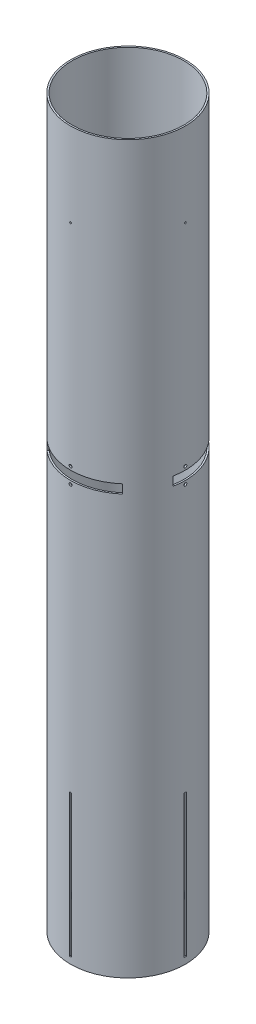
from build123d import *

# Parameters (mm, degrees)
SKETCH1_R                 = 78.359
SKETCH1_R_2               = 76.2
BOSS_EXTRUDE1_DEPTH       = 990.6
FIN_SLOTS_DEPTH           = 997.779125866
CIRPATTERN1_COUNT         = 4
CUT_EXTRUDE2_DEPTH        = 997.779125866
CIRPATTERN2_COUNT         = 4
SKETCH3_R                 = 3.175
CUT_EXTRUDE3_DEPTH        = 997.779125982
CUT_EXTRUDE4_START        = -12.065
CUT_EXTRUDE4_DEPTH        = 12.065
CIRPATTERN3_COUNT         = 3
SKETCH2_4_R               = 1.0922
SHEAR_SCREW_HOLES_DEPTH   = 997.779125982
SHEAR_SCREW_PATTERN_COUNT = 4
LPATTERN1_COUNT           = 2
LPATTERN1_PITCH           = 21.52396
LPATTERN1_COPY_1_DEPTH    = 997.779125866
LPATTERN1_COPY_2_DEPTH    = 997.779125866
LPATTERN1_COPY_3_DEPTH    = 997.779125866


with BuildPart() as part:
    # Sketch1 → Boss-Extrude1 (new body)
    with BuildSketch(Plane(origin=(0, 0, 0), x_dir=(1, 0, 0), z_dir=(0, 1, 0))):
        Circle(SKETCH1_R)
        Circle(SKETCH1_R_2, mode=Mode.SUBTRACT)
    extrude(amount=BOSS_EXTRUDE1_DEPTH)

    # Sketch2 → Fin Slots (cut, through all)
    with BuildSketch(Plane(origin=(0, 0, 0), x_dir=(0, 0, -1), z_dir=(1, 0, 0))):
        Polygon((0, 8.89), (1.5875, 8.89), (1.5875, 203.2), (-1.5875, 203.2), (-1.5875, 8.89), align=None)
    fin_slots = extrude(amount=-FIN_SLOTS_DEPTH, mode=Mode.SUBTRACT)

    # CirPattern1: Fin Slots ×4 about axis
    cirpattern1_axis = Axis((0, 0, 0), (0, 1, 0))
    for i in range(1, CIRPATTERN1_COUNT):
        add(fin_slots.rotate(cirpattern1_axis, i * 360 / CIRPATTERN1_COUNT), mode=Mode.SUBTRACT)

    # Sketch2<3> → Cut-Extrude2 (cut, through all)
    with BuildSketch(Plane(origin=(0, 0, 0), x_dir=(0, 0, -1), z_dir=(1, 0, 0))):
        with BuildLine():
            ThreePointArc((1.999996, 588.645), (1.414210734, 590.059210734), (0, 590.644996))
            ThreePointArc((0, 590.644996), (-1.414210734, 587.230789266), (1.999996, 588.645))
        make_face()
    cut_extrude2 = extrude(amount=-CUT_EXTRUDE2_DEPTH, mode=Mode.SUBTRACT)

    # CirPattern2: Cut-Extrude2 ×4 about axis
    cirpattern2_axis = Axis((0, 990.6, 0), (0, -1, 0))
    for i in range(1, CIRPATTERN2_COUNT):
        add(cut_extrude2.rotate(cirpattern2_axis, i * 360 / CIRPATTERN2_COUNT), mode=Mode.SUBTRACT)

    # Sketch3 → Cut-Extrude3 (cut, through all)
    with BuildSketch(Plane(origin=(0, 0, 0), x_dir=(0.7071067811865477, 0, -0.7071067811865475), z_dir=(0.7071067811865475, 0, 0.7071067811865477))):
        with Locations((0, 127)):
            Circle(SKETCH3_R)
    extrude(amount=-CUT_EXTRUDE3_DEPTH, mode=Mode.SUBTRACT)

    # Sketch7 → Cut-Extrude4 (cut)
    with BuildSketch(Plane(origin=(0, 583.8825, 0), x_dir=(1, 0, 0), z_dir=(0, 1, 0)).offset(CUT_EXTRUDE4_START)):
        with BuildLine():
            Line((-76.853353787, -15.287082543), (-74.735838367, -14.865882538))
            ThreePointArc((-74.735838367, -14.865882538), (-65.991135768, 38.1), (-24.493687256, 72.156075868))
            Line((-24.493687256, 72.156075868), (-25.187675062, 74.200498017))
            ThreePointArc((-25.187675062, 74.200498017), (-63.106141662, 46.451563651), (-78.333472392, 1.999996))
            ThreePointArc((-78.333472392, 1.999996), (-78.359, 0), (-78.333472392, -1.999996))
            ThreePointArc((-78.333472392, -1.999996), (-77.877303639, -8.675163336), (-76.853353787, -15.287082543))
        make_face()
    cut_extrude4 = extrude(amount=CUT_EXTRUDE4_DEPTH, mode=Mode.SUBTRACT)

    # CirPattern3: Cut-Extrude4 ×3 about axis
    cirpattern3_axis = Axis((0, 990.6, 0), (0, -1, 0))
    for i in range(1, CIRPATTERN3_COUNT):
        add(cut_extrude4.rotate(cirpattern3_axis, i * 360 / CIRPATTERN3_COUNT), mode=Mode.SUBTRACT)

    # Sketch2<4> → Shear Screw Holes (cut, through all)
    with BuildSketch(Plane(origin=(0, 0, 0), x_dir=(0, 0, -1), z_dir=(1, 0, 0))):
        with Locations((0, 876.3)):
            Circle(SKETCH2_4_R)
    shear_screw_holes = extrude(amount=-SHEAR_SCREW_HOLES_DEPTH, mode=Mode.SUBTRACT)

    # Shear Screw Pattern: Shear Screw Holes ×4 about axis
    shear_screw_pattern_axis = Axis((0, 990.6, 0), (0, -1, 0))
    for i in range(1, SHEAR_SCREW_PATTERN_COUNT):
        add(shear_screw_holes.rotate(shear_screw_pattern_axis, i * 360 / SHEAR_SCREW_PATTERN_COUNT), mode=Mode.SUBTRACT)

    # LPattern1: Cut-Extrude2 ×2
    with Locations(*[(0, -i * LPATTERN1_PITCH, 0) for i in range(1, LPATTERN1_COUNT)]):
        add(cut_extrude2, mode=Mode.SUBTRACT)

    # LPattern1 copy 1 sketch → LPattern1 copy 1 (cut, through all)
    with BuildSketch(Plane(origin=(0, -21.52396, 0), x_dir=(1, 0, 0), z_dir=(0, 0, 1))):
        with BuildLine():
            ThreePointArc((1.999996, 588.645), (1.414210734, 590.059210734), (0, 590.644996))
            ThreePointArc((0, 590.644996), (-1.414210734, 587.230789266), (1.999996, 588.645))
        make_face()
    extrude(amount=-LPATTERN1_COPY_1_DEPTH, mode=Mode.SUBTRACT)

    # LPattern1 copy 2 sketch → LPattern1 copy 2 (cut, through all)
    with BuildSketch(Plane(origin=(0, -21.52396, 0), x_dir=(0, 0, 1), z_dir=(-1, 0, 0))):
        with BuildLine():
            ThreePointArc((1.999996, 588.645), (1.414210734, 590.059210734), (0, 590.644996))
            ThreePointArc((0, 590.644996), (-1.414210734, 587.230789266), (1.999996, 588.645))
        make_face()
    extrude(amount=-LPATTERN1_COPY_2_DEPTH, mode=Mode.SUBTRACT)

    # LPattern1 copy 3 sketch → LPattern1 copy 3 (cut, through all)
    with BuildSketch(Plane(origin=(0, -21.52396, 0), x_dir=(-1, 0, 0), z_dir=(0, 0, -1))):
        with BuildLine():
            ThreePointArc((1.999996, 588.645), (1.414210734, 590.059210734), (0, 590.644996))
            ThreePointArc((0, 590.644996), (-1.414210734, 587.230789266), (1.999996, 588.645))
        make_face()
    extrude(amount=-LPATTERN1_COPY_3_DEPTH, mode=Mode.SUBTRACT)


solid = part.part
